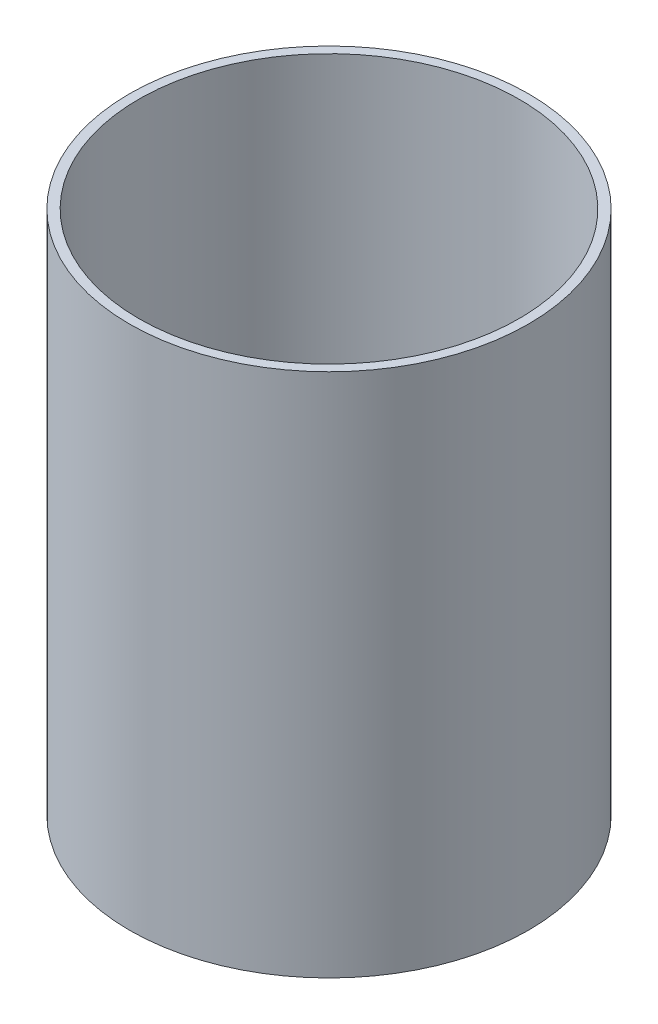
from build123d import *

# Parameters (mm, degrees)
SKETCH1_R           = 26.6
SKETCH1_R_2         = 25.35
BOSS_EXTRUDE1_DEPTH = 70


with BuildPart() as part:
    # Sketch1 → Boss-Extrude1 (new body)
    with BuildSketch(Plane(origin=(0, 0, 0), x_dir=(1, 0, 0), z_dir=(0, 1, 0))):
        Circle(SKETCH1_R)
        Circle(SKETCH1_R_2, mode=Mode.SUBTRACT)
    extrude(amount=BOSS_EXTRUDE1_DEPTH)


solid = part.part
